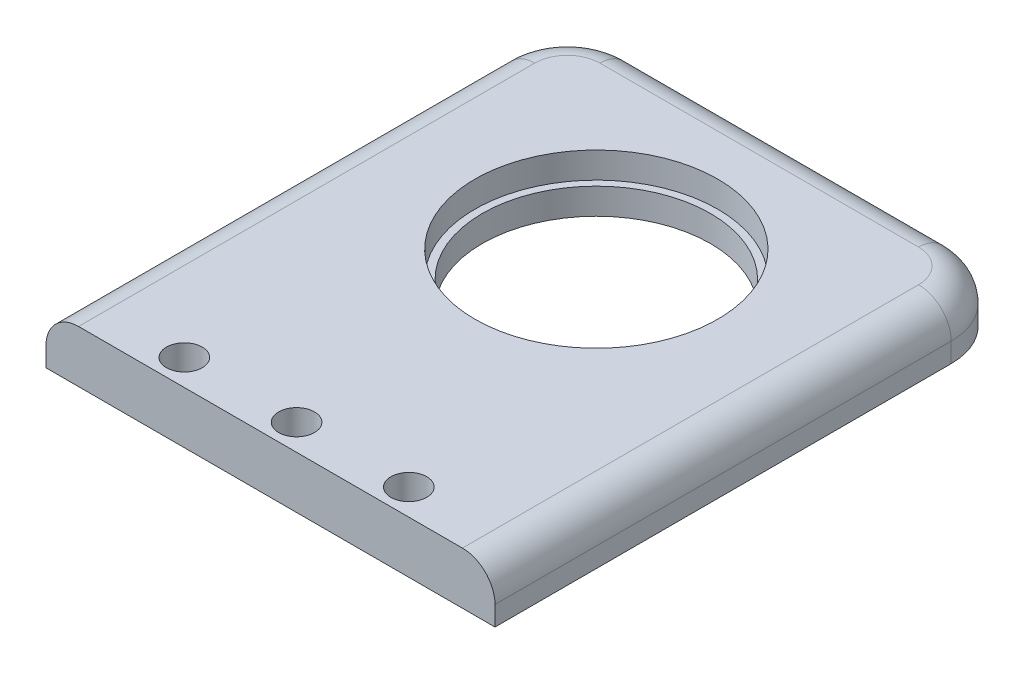
from build123d import *

# Parameters (mm, degrees)
SKETCH1_W           = 68.9
SKETCH1_H           = 80
SKETCH1_R           = 18.63
SKETCH1_R_2         = 2.75
BOSS_EXTRUDE1_DEPTH = 8
FILLET1_R           = 10
FILLET2_R           = 5
SKETCH2_R           = 18.63
SKETCH2_R_2         = 17.5
BOSS_EXTRUDE2_DEPTH = 4


with BuildPart() as part:
    # Sketch1 → Boss-Extrude1 (new body)
    with BuildSketch(Plane(origin=(0, 0, 0), x_dir=(1, 0, 0), z_dir=(0, 1, 0))):
        with Locations((0.722348924, 0)):
            Rectangle(SKETCH1_W, SKETCH1_H)
        with Locations((0.722348924, 10)):
            Circle(SKETCH1_R, mode=Mode.SUBTRACT)
        with Locations((0.722348924, -36)):
            Circle(SKETCH1_R_2, mode=Mode.SUBTRACT)
        with Locations((-16.502651076, -36)):
            Circle(SKETCH1_R_2, mode=Mode.SUBTRACT)
        with Locations((17.947348924, -36)):
            Circle(SKETCH1_R_2, mode=Mode.SUBTRACT)
    extrude(amount=BOSS_EXTRUDE1_DEPTH)

    # Fillet1
    fillet1_edges = [part.edges().sort_by_distance(p)[0] for p in [
        (35.172348924, 4, -40),
        (-33.727651076, 4, -40),
    ]]
    fillet(fillet1_edges, radius=FILLET1_R)

    # Fillet2
    fillet2_edges = [part.edges().sort_by_distance(p)[0] for p in [
        (32.243416735, 8, -37.071067812),
        (0.722348924, 8, -40),
        (-30.798718888, 8, -37.071067812),
        (35.172348924, 8, 5),
        (-33.727651076, 8, 5),
    ]]
    fillet(fillet2_edges, radius=FILLET2_R)

    # Sketch2 → Boss-Extrude2 (add)
    with BuildSketch(Plane.XZ):
        with Locations((0.722348924, -10)):
            Circle(SKETCH2_R)
        with Locations((0.722348924, -10)):
            Circle(SKETCH2_R_2, mode=Mode.SUBTRACT)
    extrude(amount=-BOSS_EXTRUDE2_DEPTH)


solid = part.part
